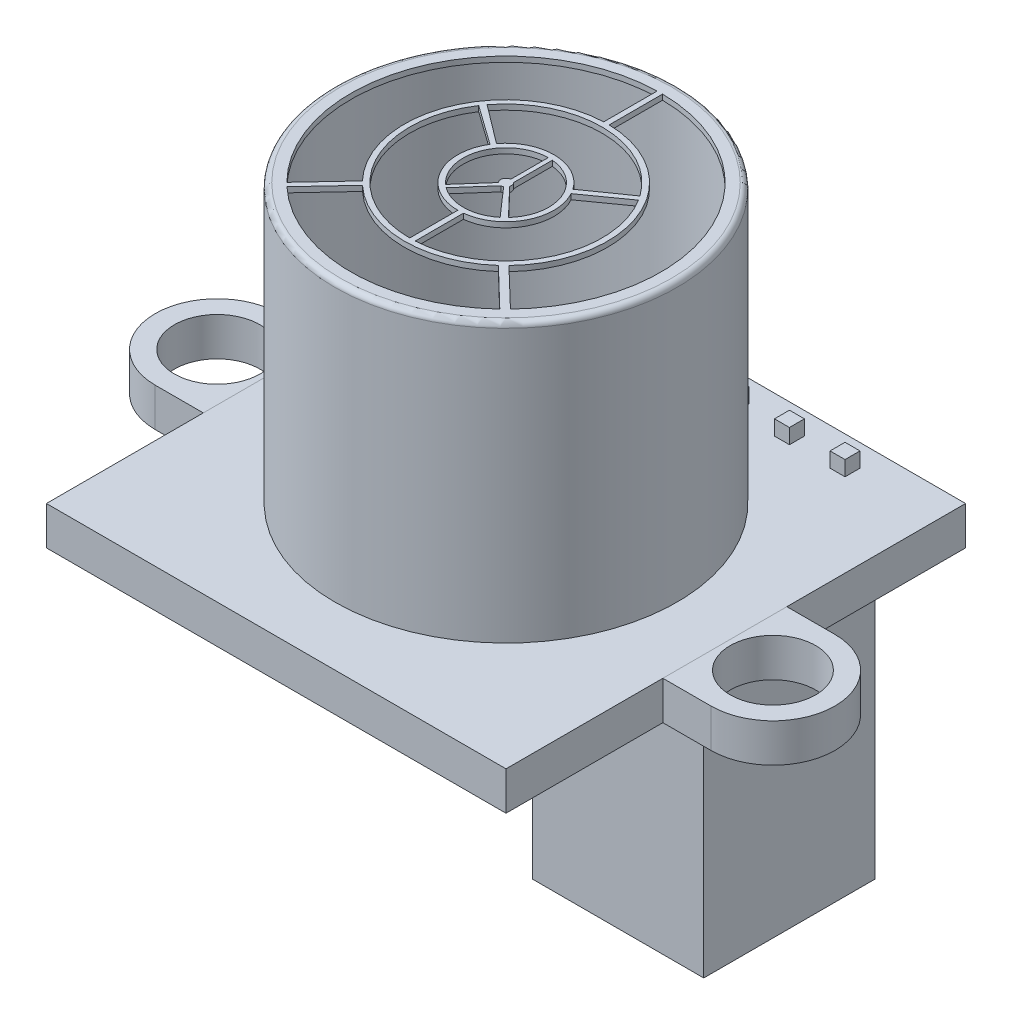
from build123d import *

# Parameters (mm, degrees)
SKETCH2_W                 = 21.5
SKETCH2_H                 = 21.5
BOSS_EXTRUDE1_DEPTH       = 1.8
SKETCH3_R                 = 2
BOSS_EXTRUDE2_DEPTH       = 1.8
BOSS_EXTRUDE2_2_DEPTH     = 1.8
EXTRUDE_THIN1_OUTLINE_R   = 8
EXTRUDE_THIN1_OUTLINE_R_2 = 7.5
EXTRUDE_THIN1_DEPTH       = 13
EXTRUDE_THIN1_2_OUTLINE_R = 7.5
EXTRUDE_THIN1_2_DEPTH     = 0.25
EXTRUDE_THIN1_START       = 12.75
EXTRUDE_THIN1_3_OUTLINE_R = 7.5
EXTRUDE_THIN1_3_DEPTH     = 0.25
FILLET1_R                 = 0.25
CUT_EXTRUDE2_DEPTH        = 1
CUT_EXTRUDE3_DEPTH        = 1
CUT_EXTRUDE4_DEPTH        = 1
SKETCH9_W                 = 8
SKETCH9_H                 = 8
BOSS_EXTRUDE3_DEPTH       = 11.8
BOSS_EXTRUDE4_DEPTH       = 2.5
BOSS_EXTRUDE5_DEPTH       = 6.5
BOSS_EXTRUDE5_DEPTH_BACK  = 5
SKETCH11_W                = 0.7
SKETCH11_H                = 0.7


# Read off the part's stored shape, not the designer's step: Extrude-Thin1
with BuildPart() as part:
    # Sketch2 → Boss-Extrude1 (new body)
    with BuildSketch(Plane(origin=(0, 0, 0), x_dir=(1, 0, 0), z_dir=(0, 1, 0))):
        with Locations((-1.969219219, -2.388888889)):
            Rectangle(SKETCH2_W, SKETCH2_H)
    extrude(amount=BOSS_EXTRUDE1_DEPTH)

    # Extrude-Thin1 outline → Extrude-Thin1 (add)
    with BuildSketch(Plane(origin=(0, 1.8, 0), x_dir=(1, 0, 0), z_dir=(0, 1, 0))):
        with Locations((-1.969219219, -2.388888889)):
            Circle(EXTRUDE_THIN1_OUTLINE_R)
        with Locations((-1.969219219, -2.388888889)):
            Circle(EXTRUDE_THIN1_OUTLINE_R_2, mode=Mode.SUBTRACT)
    extrude(amount=EXTRUDE_THIN1_DEPTH)

    # Extrude-Thin1 2 outline → Extrude-Thin1 2 (add)
    with BuildSketch(Plane(origin=(0, 1.8, 0), x_dir=(1, 0, 0), z_dir=(0, 1, 0))):
        with Locations((-1.969219219, -2.388888889)):
            Circle(EXTRUDE_THIN1_2_OUTLINE_R)
    extrude(amount=EXTRUDE_THIN1_2_DEPTH)

    # Extrude-Thin1 3 outline → Extrude-Thin1 3 (add)
    with BuildSketch(Plane(origin=(0, 1.8, 0), x_dir=(1, 0, 0), z_dir=(0, 1, 0)).offset(EXTRUDE_THIN1_START)):
        with Locations((-1.969219219, -2.388888889)):
            Circle(EXTRUDE_THIN1_3_OUTLINE_R)
    extrude(amount=EXTRUDE_THIN1_3_DEPTH)

    # Fillet1
    fillet1_edges = [part.edges().sort_by_distance(p)[0] for p in [
        (-9.969219219, 14.8, 2.388888889),
    ]]
    fillet(fillet1_edges, radius=FILLET1_R)

    # Sketch5 → Cut-Extrude2 (cut)
    with BuildSketch(Plane(origin=(0, 14.8, 0), x_dir=(1, 0, 0), z_dir=(0, 1, 0))):
        with BuildLine():
            Line((-1.993826484, -2.140102871), (-1.993826484, -0.389040274))
            ThreePointArc((-1.993826484, -0.389040274), (-3.840560582, -1.683139994), (-3.308295405, -3.87444433))
            Line((-3.308295405, -3.87444433), (-2.149013784, -2.562595292))
            ThreePointArc((-2.149013784, -2.562595292), (-2.203889175, -2.302691374), (-1.993826484, -2.140102871))
        make_face()
        with BuildLine():
            Line((-1.793826484, -2.210738984), (-1.793826484, -0.396594385))
            ThreePointArc((-1.793826484, -0.396594385), (-0.104047632, -1.666992116), (-0.498254353, -3.743976474))
            Line((-0.498254353, -3.743976474), (-1.729378138, -2.459431469))
            ThreePointArc((-1.729378138, -2.459431469), (-1.727213499, -2.326173409), (-1.793826484, -2.210738984))
        make_face()
        with BuildLine():
            Line((-1.964115885, -2.638836795), (-3.16195163, -3.994313878))
            ThreePointArc((-3.16195163, -3.994313878), (-1.919557705, -4.388272227), (-0.698254353, -3.933119542))
            Line((-0.698254353, -3.933119542), (-1.857849958, -2.612712229))
            ThreePointArc((-1.857849958, -2.612712229), (-1.909535975, -2.631660202), (-1.964115885, -2.638836795))
        make_face()
    extrude(amount=-CUT_EXTRUDE2_DEPTH, mode=Mode.SUBTRACT)

    # Sketch7 → Cut-Extrude3 (cut)
    with BuildSketch(Plane(origin=(0, 14.8, 0), x_dir=(1, 0, 0), z_dir=(0, 1, 0))):
        with BuildLine():
            Line((-0.136146833, -1.09207981), (1.704555655, 0.201873183))
            ThreePointArc((1.704555655, 0.201873183), (-1.900589009, 2.113320968), (-5.568439236, 0.325144411))
            Line((-5.568439236, 0.325144411), (-3.772644279, -1.030444196))
            ThreePointArc((-3.772644279, -1.030444196), (-1.938719165, -0.136355917), (-0.136146833, -1.09207981))
        make_face()
        with BuildLine():
            Line((0, -1.311525121), (1.838494367, 0))
            ThreePointArc((1.838494367, 0), (2.018422951, -4.45673304), (-1.726849322, -6.879082992))
            Line((-1.726849322, -6.879082992), (-1.726849322, -4.622100781))
            ThreePointArc((-1.726849322, -4.622100781), (0.018067287, -3.426613278), (0, -1.311525121))
        make_face()
        with BuildLine():
            Line((-3.896300651, -1.212062364), (-5.730286383, 0.096246436))
            ThreePointArc((-5.730286383, 0.096246436), (-5.940449742, -4.516730274), (-1.976849322, -6.886032803))
            Line((-1.976849322, -6.886032803), (-1.976849322, -4.636032803))
            ThreePointArc((-1.976849322, -4.636032803), (-3.939492118, -3.486275166), (-3.896300651, -1.212062364))
        make_face()
    extrude(amount=-CUT_EXTRUDE3_DEPTH, mode=Mode.SUBTRACT)

    # Sketch8 → Cut-Extrude4 (cut)
    with BuildSketch(Plane(origin=(0, 14.8, 0), x_dir=(1, 0, 0), z_dir=(0, 1, 0))):
        with BuildLine():
            Line((-2.144611484, 2.357871854), (-2.144611484, 4.858989253))
            ThreePointArc((-2.144611484, 4.858989253), (-8.697508795, 0.311596139), (-7.106791962, -7.50434061))
            Line((-7.106791962, -7.50434061), (-5.395497678, -5.678739329))
            ThreePointArc((-5.395497678, -5.678739329), (-6.372602899, -0.607678017), (-2.144611484, 2.357871854))
        make_face()
        with BuildLine():
            Line((-1.894611484, 2.360525147), (-1.894611484, 4.860727217))
            ThreePointArc((-1.894611484, 4.860727217), (4.714923659, 0.419087959), (3.260363692, -7.410239561))
            Line((3.260363692, -7.410239561), (1.45705924, -5.678739329))
            ThreePointArc((1.45705924, -5.678739329), (2.415013253, -0.561047092), (-1.894611484, 2.360525147))
        make_face()
        with BuildLine():
            Line((-6.927368853, -7.678430666), (-5.217662083, -5.854450743))
            ThreePointArc((-5.217662083, -5.854450743), (-2.018203637, -7.138636306), (1.20705924, -5.920709262))
            Line((1.20705924, -5.920709262), (3.010363692, -7.658258304))
            ThreePointArc((3.010363692, -7.658258304), (-1.95450265, -9.638873953), (-6.927368853, -7.678430666))
        make_face()
    extrude(amount=-CUT_EXTRUDE4_DEPTH, mode=Mode.SUBTRACT)

    # Sketch9 → Boss-Extrude3 (add)
    with BuildSketch(Plane.XZ):
        with Locations((4.280780781, -0.611915771)):
            Rectangle(SKETCH9_W, SKETCH9_H)
    extrude(amount=BOSS_EXTRUDE3_DEPTH)

    # Sketch10 → Boss-Extrude4 (add)
    with BuildSketch(Plane.XZ):
        with BuildLine():
            Line((-9.469219219, -8.261111111), (-7.479219219, -8.261111111))
            ThreePointArc((-7.479219219, -8.261111111), (-7.267087185, -8.173243145), (-7.179219219, -7.961111111))
            Line((-7.179219219, -7.961111111), (-7.179219219, -5.971111111))
            ThreePointArc((-7.179219219, -5.971111111), (-7.267087185, -5.758979077), (-7.479219219, -5.671111111))
            Line((-7.479219219, -5.671111111), (-9.469219219, -5.671111111))
            ThreePointArc((-9.469219219, -5.671111111), (-9.681351254, -5.758979077), (-9.769219219, -5.971111111))
            Line((-9.769219219, -5.971111111), (-9.769219219, -7.961111111))
            ThreePointArc((-9.769219219, -7.961111111), (-9.681351254, -8.173243145), (-9.469219219, -8.261111111))
        make_face()
        with BuildLine():
            Line((-7.169219219, -7.961111111), (-7.169219219, -5.971111111))
            ThreePointArc((-7.169219219, -5.971111111), (-7.081351254, -5.758979077), (-6.869219219, -5.671111111))
            Line((-6.869219219, -5.671111111), (-4.879219219, -5.671111111))
            ThreePointArc((-4.879219219, -5.671111111), (-4.667087185, -5.758979077), (-4.579219219, -5.971111111))
            Line((-4.579219219, -5.971111111), (-4.579219219, -7.961111111))
            ThreePointArc((-4.579219219, -7.961111111), (-4.667087185, -8.173243145), (-4.879219219, -8.261111111))
            Line((-4.879219219, -8.261111111), (-6.869219219, -8.261111111))
            ThreePointArc((-6.869219219, -8.261111111), (-7.081351254, -8.173243145), (-7.169219219, -7.961111111))
        make_face()
        with BuildLine():
            Line((-4.569219219, -7.961111111), (-4.569219219, -5.971111111))
            ThreePointArc((-4.569219219, -5.971111111), (-4.481351254, -5.758979077), (-4.269219219, -5.671111111))
            Line((-4.269219219, -5.671111111), (-2.279219219, -5.671111111))
            ThreePointArc((-2.279219219, -5.671111111), (-2.067087185, -5.758979077), (-1.979219219, -5.971111111))
            Line((-1.979219219, -5.971111111), (-1.979219219, -7.961111111))
            ThreePointArc((-1.979219219, -7.961111111), (-2.067087185, -8.173243145), (-2.279219219, -8.261111111))
            Line((-2.279219219, -8.261111111), (-4.269219219, -8.261111111))
            ThreePointArc((-4.269219219, -8.261111111), (-4.481351254, -8.173243145), (-4.569219219, -7.961111111))
        make_face()
        with BuildLine():
            Line((-1.969219219, -7.961111111), (-1.969219219, -5.971111111))
            ThreePointArc((-1.969219219, -5.971111111), (-1.881351254, -5.758979077), (-1.669219219, -5.671111111))
            Line((-1.669219219, -5.671111111), (0.320780781, -5.671111111))
            ThreePointArc((0.320780781, -5.671111111), (0.532912815, -5.758979077), (0.620780781, -5.971111111))
            Line((0.620780781, -5.971111111), (0.620780781, -7.961111111))
            ThreePointArc((0.620780781, -7.961111111), (0.532912815, -8.173243145), (0.320780781, -8.261111111))
            Line((0.320780781, -8.261111111), (-1.669219219, -8.261111111))
            ThreePointArc((-1.669219219, -8.261111111), (-1.881351254, -8.173243145), (-1.969219219, -7.961111111))
        make_face()
        with BuildLine():
            Line((0.630780781, -7.961111111), (0.630780781, -5.971111111))
            ThreePointArc((0.630780781, -5.971111111), (0.718648746, -5.758979077), (0.930780781, -5.671111111))
            Line((0.930780781, -5.671111111), (2.920780781, -5.671111111))
            ThreePointArc((2.920780781, -5.671111111), (3.132912815, -5.758979077), (3.220780781, -5.971111111))
            Line((3.220780781, -5.971111111), (3.220780781, -7.961111111))
            ThreePointArc((3.220780781, -7.961111111), (3.132912815, -8.173243145), (2.920780781, -8.261111111))
            Line((2.920780781, -8.261111111), (0.930780781, -8.261111111))
            ThreePointArc((0.930780781, -8.261111111), (0.718648746, -8.173243145), (0.630780781, -7.961111111))
        make_face()
        with BuildLine():
            Line((3.230780781, -7.961111111), (3.230780781, -5.971111111))
            ThreePointArc((3.230780781, -5.971111111), (3.318648746, -5.758979077), (3.530780781, -5.671111111))
            Line((3.530780781, -5.671111111), (5.520780781, -5.671111111))
            ThreePointArc((5.520780781, -5.671111111), (5.732912815, -5.758979077), (5.820780781, -5.971111111))
            Line((5.820780781, -5.971111111), (5.820780781, -7.961111111))
            ThreePointArc((5.820780781, -7.961111111), (5.732912815, -8.173243145), (5.520780781, -8.261111111))
            Line((5.520780781, -8.261111111), (3.530780781, -8.261111111))
            ThreePointArc((3.530780781, -8.261111111), (3.318648746, -8.173243145), (3.230780781, -7.961111111))
        make_face()
    extrude(amount=BOSS_EXTRUDE4_DEPTH)

    # Sketch11 → Boss-Extrude5 (add, two sides: drawn at the far end of the back side and taken through both)
    with BuildSketch(Plane.XZ.offset(2.5).offset(-BOSS_EXTRUDE5_DEPTH_BACK)):
        with Locations((-8.469219219, -6.971111111)):
            Rectangle(SKETCH11_W, SKETCH11_H)
        with Locations((-5.869219219, -6.971111111)):
            Rectangle(SKETCH11_W, SKETCH11_H)
        with Locations((-3.269219219, -6.971111111)):
            Rectangle(SKETCH11_W, SKETCH11_H)
        with Locations((-0.669219219, -6.971111111)):
            Rectangle(SKETCH11_W, SKETCH11_H)
        with Locations((1.930780781, -6.971111111)):
            Rectangle(SKETCH11_W, SKETCH11_H)
        with Locations((4.530780781, -6.971111111)):
            Rectangle(SKETCH11_W, SKETCH11_H)
    extrude(amount=BOSS_EXTRUDE5_DEPTH + BOSS_EXTRUDE5_DEPTH_BACK)


with BuildPart() as body_2:
    # Sketch3 → Boss-Extrude2 (new body)
    with BuildSketch(Plane(origin=(0, 1.8, 0), x_dir=(1, 0, 0), z_dir=(0, 1, 0))):
        with BuildLine():
            Line((8.780780781, 0), (11.030780781, 0))
            ThreePointArc((11.030780781, 0), (13.930780781, -2.9), (11.030780781, -5.8))
            Line((11.030780781, -5.8), (8.780780781, -5.8))
            Line((8.780780781, -5.8), (8.780780781, 0))
        make_face()
        with Locations(Location((11.030780781, -2.9, 0), (0, 0, 270))):
            Circle(SKETCH3_R, mode=Mode.SUBTRACT)
    extrude(amount=-BOSS_EXTRUDE2_DEPTH)


with BuildPart() as body_3:
    # Sketch3 → Boss-Extrude2 2 (new body)
    with BuildSketch(Plane(origin=(0, 1.8, 0), x_dir=(1, 0, 0), z_dir=(0, 1, 0))):
        with BuildLine():
            Line((-12.719219219, -5.8), (-14.969219219, -5.8))
            ThreePointArc((-14.969219219, -5.8), (-17.869219219, -2.9), (-14.969219219, 0))
            Line((-14.969219219, 0), (-12.719219219, 0))
            Line((-12.719219219, 0), (-12.719219219, -5.8))
        make_face()
        with Locations(Location((-14.969219219, -2.9, 0), (0, 0, 270))):
            Circle(SKETCH3_R, mode=Mode.SUBTRACT)
    extrude(amount=-BOSS_EXTRUDE2_2_DEPTH)


solid = Compound([part.part, body_2.part, body_3.part])
